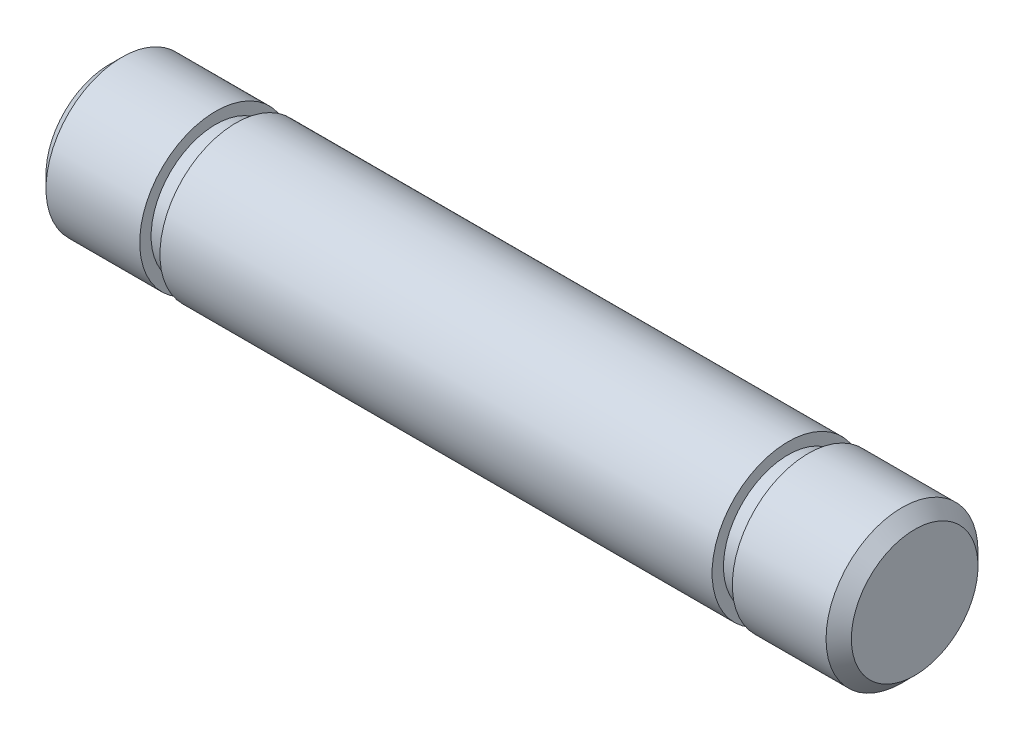
from build123d import *

# Parameters (mm, degrees)
CHAFL_N1_SIZE = 0.5


with BuildPart() as part:
    # Croquis1 → Revolución1 (revolve)
    with BuildSketch(Plane(origin=(0, 0, 0), x_dir=(-1, 0, 0), z_dir=(0, 1, 0))):
        Polygon((-10.9, 3), (10.9, 3), (10.9, 2.55), (11.7, 2.55), (11.7, 3), (15.9, 3), (15.9, 0), (-15.9, 0), (-15.9, 3), (-11.7, 3), (-11.7, 2.55), (-10.9, 2.55), align=None)
    revolve(axis=Axis((15.9, 0, 0), (-1, 0, 0)))

    # Chaflán1
    chafl_n1_edges = [part.edges().sort_by_distance(p)[0] for p in [
        (15.9, 0, -3),
        (-15.9, 0, -3),
    ]]
    chamfer(chafl_n1_edges, length=CHAFL_N1_SIZE)


solid = part.part
